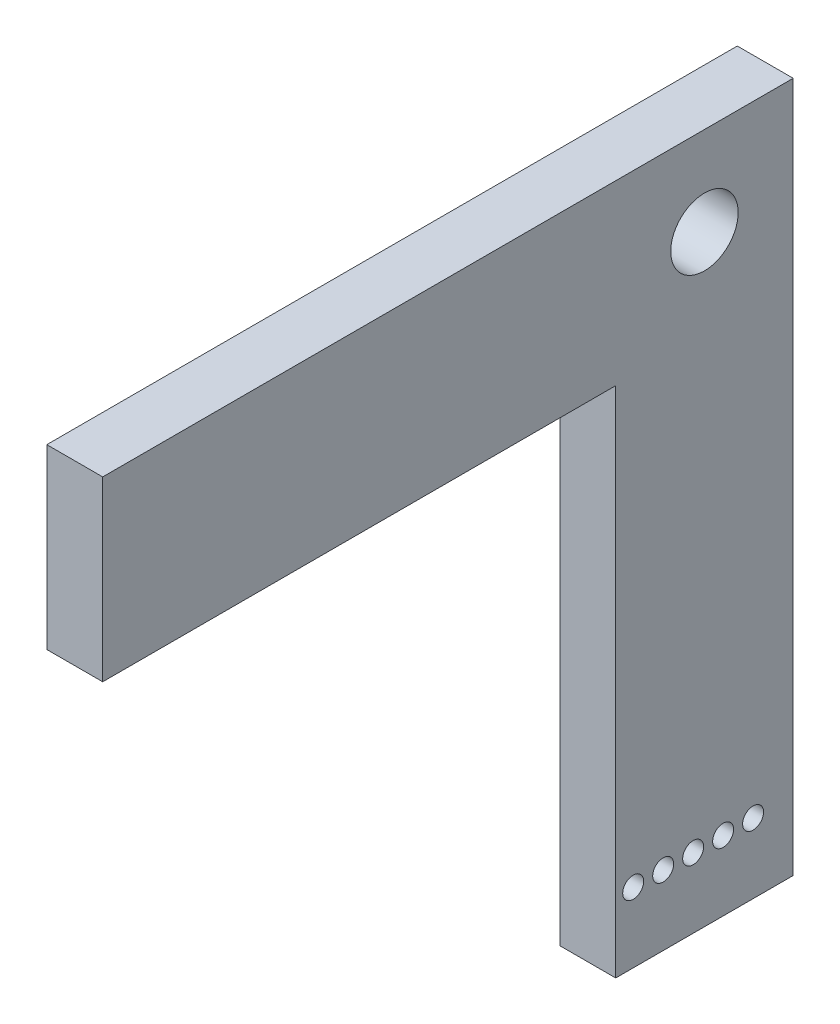
from build123d import *

# Parameters (mm, degrees)
SKETCH1_R           = 2.413
SKETCH1_R_2         = 0.75
BOSS_EXTRUDE1_DEPTH = 2


with BuildPart() as part:
    # Sketch1 → Boss-Extrude1 (new, symmetric)
    with BuildSketch(Plane(origin=(0, 0, 0), x_dir=(0, 0, -1), z_dir=(1, 0, 0))):
        Polygon((-43.06614877, 6.35), (6.35, 6.35), (6.35, -43.06614877), (-6.35, -43.06614877), (-6.35, -6.35), (-43.06614877, -6.35), align=None)
        Circle(SKETCH1_R, mode=Mode.SUBTRACT)
        with Locations((-5.1, -38.06614877)):
            Circle(SKETCH1_R_2, mode=Mode.SUBTRACT)
        with Locations((-2.954545455, -38.06614877)):
            Circle(SKETCH1_R_2, mode=Mode.SUBTRACT)
        with Locations((-0.809090909, -38.06614877)):
            Circle(SKETCH1_R_2, mode=Mode.SUBTRACT)
        with Locations((1.336363636, -38.06614877)):
            Circle(SKETCH1_R_2, mode=Mode.SUBTRACT)
        with Locations((3.481818182, -38.06614877)):
            Circle(SKETCH1_R_2, mode=Mode.SUBTRACT)
    extrude(amount=BOSS_EXTRUDE1_DEPTH, both=True)


solid = part.part
